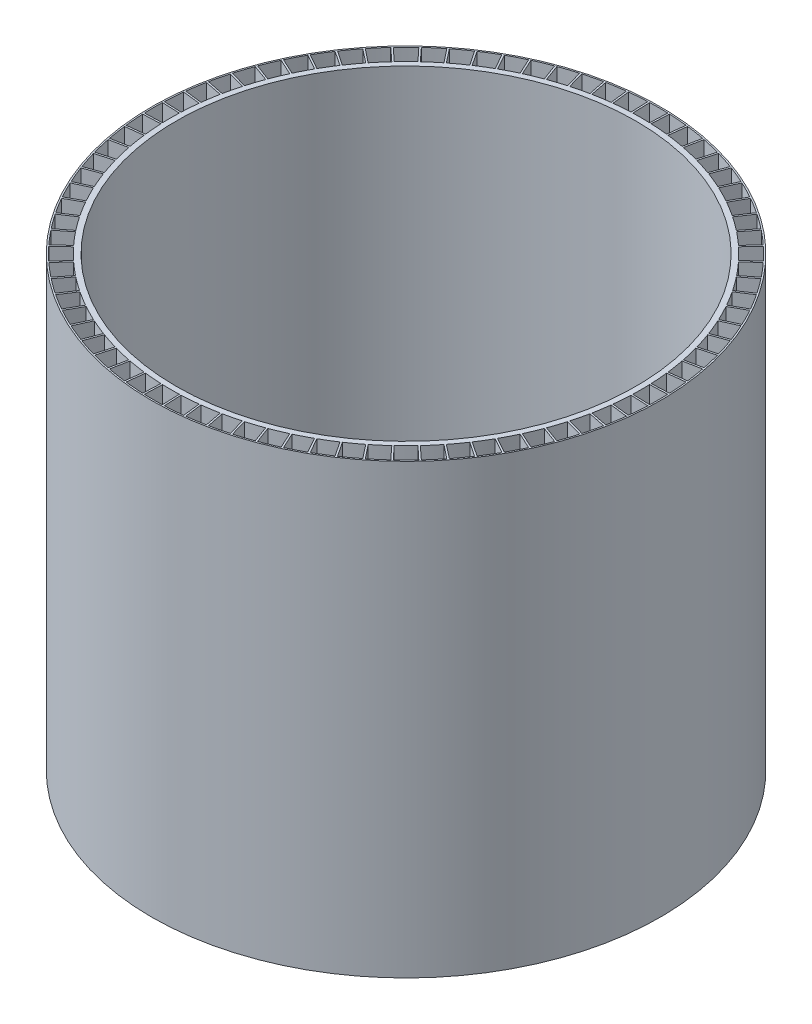
from build123d import *

# Parameters (mm, degrees)
BOSS_EXTRUDE1_DEPTH = 165.92022954
CIRPATTERN1_COUNT   = 80
SKETCH5_R           = 1.525
BOSS_EXTRUDE2_DEPTH = 12.7


with BuildPart() as part:
    # Sketch2 → Boss-Extrude1 (new body)
    with BuildSketch(Plane(origin=(0, 0, 0), x_dir=(1, 0, 0), z_dir=(0, 1, 0))):
        with BuildLine():
            Line((-94.269373414, -4.040952325), (-85.16972978, -3.650886869))
            ThreePointArc((-85.16972978, -3.650886869), (-85.247943352, 0), (-85.16972978, 3.650886869))
            Line((-85.16972978, 3.650886869), (-94.269373414, 4.040952325))
            ThreePointArc((-94.269373414, 4.040952325), (-94.355943424, 0), (-94.269373414, -4.040952325))
        make_face()
        with BuildLine():
            Line((-93.695321597, 3.370997631), (-87.191529674, 3.137002307))
            ThreePointArc((-87.191529674, 3.137002307), (-87.247943416, 0), (-87.191529674, -3.137002307))
            Line((-87.191529674, -3.137002307), (-93.695321597, -3.370997631))
            ThreePointArc((-93.695321597, -3.370997631), (-93.755943354, 0), (-93.695321597, 3.370997631))
        make_face(mode=Mode.SUBTRACT)
    boss_extrude1 = extrude(amount=BOSS_EXTRUDE1_DEPTH)

    # CirPattern1: Boss-Extrude1 ×80 about axis
    cirpattern1_axis = Axis((0, 160.02, 0), (0, -1, 0))
    for i in range(1, CIRPATTERN1_COUNT):
        add(boss_extrude1.rotate(cirpattern1_axis, i * 360 / CIRPATTERN1_COUNT))

    # Sketch5 → Boss-Extrude2 (add)
    with BuildSketch(Plane(origin=(0, 0, 0), x_dir=(1, 0, 0), z_dir=(0, 1, 0))):
        with BuildLine():
            Line((-82.5, -3.75), (-86.166381136, -3.75))
            ThreePointArc((-86.166381136, -3.75), (-86.247943384, 0), (-86.166381136, 3.75))
            Line((-86.166381136, 3.75), (-82.5, 3.75))
            ThreePointArc((-82.5, 3.75), (-78.75, 0), (-82.5, -3.75))
        make_face()
        with Locations((-82.5, 0)):
            Circle(SKETCH5_R, mode=Mode.SUBTRACT)
    extrude(amount=BOSS_EXTRUDE2_DEPTH)


solid = part.part
